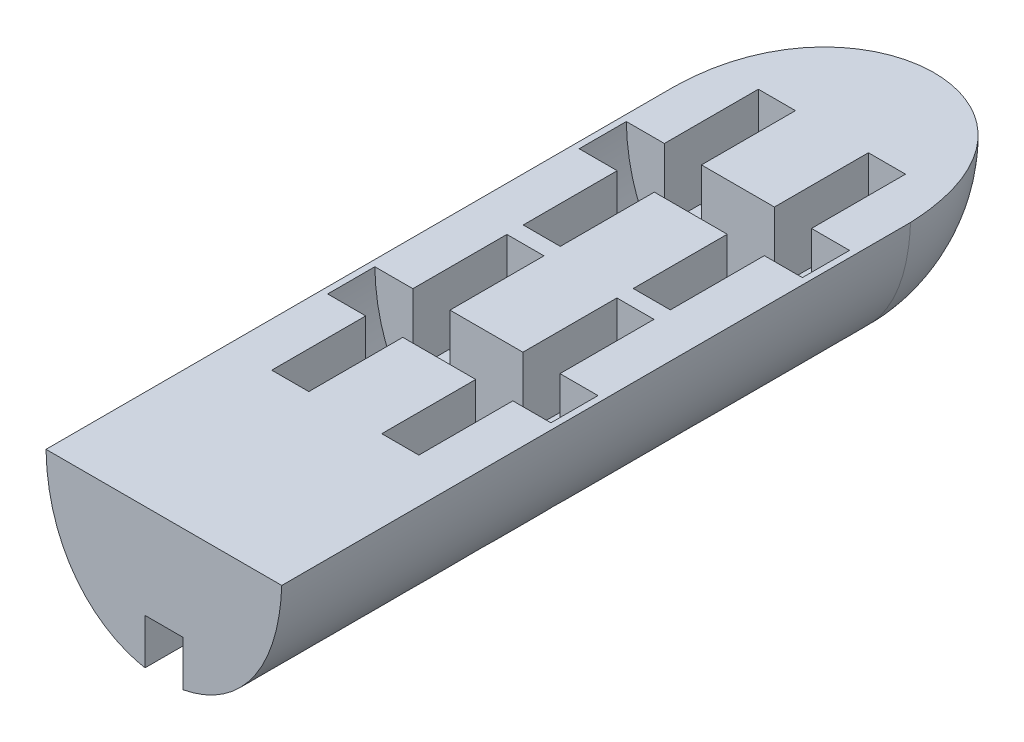
from build123d import *

# Parameters (mm, degrees)
BOSS_EXTRUDE1_DEPTH = 200
REVOLVE1_ANGLE      = 90
SKETCH7_W           = 11.8
SKETCH7_H           = 29.9
CUT_EXTRUDE1_DEPTH  = 22.5
CUT_EXTRUDE2_START  = 17.4
CUT_EXTRUDE2_DEPTH  = 15
CUT_EXTRUDE3_START  = -22.5
SKETCH7_4_W         = 11.8
SKETCH7_4_H         = 2.7
CUT_EXTRUDE3_DEPTH  = 4.7
LPATTERN1_COUNT     = 2
LPATTERN1_PITCH     = 80
CUT_EXTRUDE4_START  = -45
SKETCH9_W           = 12
SKETCH9_H           = 31.9
CUT_EXTRUDE4_DEPTH  = 15
CUT_EXTRUDE5_START  = -30
SKETCH9_3_W         = 12
SKETCH9_3_H         = 22.5
CUT_EXTRUDE5_DEPTH  = 15.9
CUT_EXTRUDE7_START  = -30
SKETCH9_4_R         = 0.5
CUT_EXTRUDE7_DEPTH  = 1


# Read off the part's stored shape, not the designer's step: Cut-Extrude2
with BuildPart() as part:
    # Sketch1 → Boss-Extrude1 (new body)
    with BuildSketch(Plane.XY):
        with BuildLine():
            Line((-37.5, 45), (37.5, 45))
            add(Edge.make_bspline(
                [(-37.5, 45), (-36.538066416, -13.829055166), (35.114143496, -16.15963011), (37.5, 45)],
                knots=[0, 0, 0, 0, 1, 1, 1, 1], degree=3))
        make_face()
    extrude(amount=BOSS_EXTRUDE1_DEPTH)

    # Sketch1<2> → Revolve1 (revolve)
    with BuildSketch(Plane.XY):
        with BuildLine():
            Line((37.5, 45), (-37.5, 45))
            add(Edge.make_bspline(
                [(-37.5, 45), (-36.538066416, -13.829055166), (35.114143496, -16.15963011), (37.5, 45)],
                knots=[0, 0, 0, 0, 1, 1, 1, 1], degree=3))
        make_face()
    revolve(axis=Axis((-37.5, 45, 0), (1, 0, 0)), revolution_arc=REVOLVE1_ANGLE)

    # Sketch7 → Cut-Extrude1 (cut)
    with BuildSketch(Plane(origin=(0, 45, 0), x_dir=(1, 0, 0), z_dir=(0, 1, 0))):
        with Locations((-17.5, -2.45)):
            Rectangle(SKETCH7_W, SKETCH7_H)
        with Locations((17.5, -2.45)):
            Rectangle(SKETCH7_W, SKETCH7_H)
        with Locations((-17.5, -47.35)):
            Rectangle(SKETCH7_W, SKETCH7_H)
        with Locations((17.5, -47.35)):
            Rectangle(SKETCH7_W, SKETCH7_H)
    cut_extrude1 = extrude(amount=-CUT_EXTRUDE1_DEPTH, mode=Mode.SUBTRACT)

    # Cut-Extrude2 outline → Cut-Extrude2 (cut)
    with BuildSketch(Plane.XY.offset(CUT_EXTRUDE2_START)):
        with BuildLine():
            Line((35.498438873, 45), (-35.499725066, 45))
            add(Edge.make_bspline(
                [(-35.499725066, 45), (-35.368650609, 37.205082169), (-34.301979481, 30.199561306), (-32.413613618, 23.984635954), (-29.817810175, 18.556811549), (-26.625334767, 13.909452625), (-22.944999564, 10.026846468), (-18.86488359, 6.899280201), (-14.482583961, 4.530449937), (-9.895330776, 2.922239991), (-5.202441131, 2.078686183), (4.195747969, 1.92933157), (8.901042205, 2.622767579), (13.515468258, 4.088792702), (17.941749121, 6.331594499), (22.084774291, 9.360328131), (25.852428778, 13.179838208), (29.158791013, 17.820930982), (31.88915848, 23.308583975), (33.93262988, 29.659944885), (35.173667519, 36.887661716), (35.498438873, 45)],
                knots=[0.000190564, 0.000190564, 0.000190564, 0.000190564, 0.000190564, 0.000190564, 0.000190564, 0.000190564, 0.000190564, 0.000190564, 0.000190564, 0.000190564, 0.5, 0.5, 0.5, 0.5, 0.5, 0.5, 0.5, 0.5, 0.5, 0.5, 0.999563761, 0.999563761, 0.999563761, 0.999563761, 0.999563761, 0.999563761, 0.999563761, 0.999563761, 0.999563761, 0.999563761, 0.999563761, 0.999563761], degree=11))
        make_face()
    cut_extrude2 = extrude(amount=CUT_EXTRUDE2_DEPTH, mode=Mode.SUBTRACT)

    # Sketch7<4> → Cut-Extrude3 (cut)
    with BuildSketch(Plane(origin=(0, 45, 0), x_dir=(1, 0, 0), z_dir=(0, 1, 0)).offset(CUT_EXTRUDE3_START)):
        with Locations((-17.5, -4.65)):
            Rectangle(SKETCH7_4_W, SKETCH7_4_H)
        with Locations((17.5, -4.55)):
            Rectangle(SKETCH7_4_W, SKETCH7_4_H)
        with Locations((17.5, -45.15)):
            Rectangle(SKETCH7_4_W, SKETCH7_4_H)
        with Locations((-17.5, -45.15)):
            Rectangle(SKETCH7_4_W, SKETCH7_4_H)
    cut_extrude3 = extrude(amount=-CUT_EXTRUDE3_DEPTH, mode=Mode.SUBTRACT)

    # LPattern1: Cut-Extrude1, Cut-Extrude2, Cut-Extrude3 ×2
    with Locations(*[(0, 0, i * LPATTERN1_PITCH) for i in range(1, LPATTERN1_COUNT)]):
        add(cut_extrude1, mode=Mode.SUBTRACT)
        add(cut_extrude2, mode=Mode.SUBTRACT)
        add(cut_extrude3, mode=Mode.SUBTRACT)

    # Sketch9 → Cut-Extrude4 (cut)
    with BuildSketch(Plane(origin=(0, 45, 0), x_dir=(1, 0, 0), z_dir=(0, 1, 0)).offset(CUT_EXTRUDE4_START)):
        with Locations((0, -184.05)):
            Rectangle(SKETCH9_W, SKETCH9_H)
    extrude(amount=CUT_EXTRUDE4_DEPTH, mode=Mode.SUBTRACT)

    # Sketch9<3> → Cut-Extrude5 (cut)
    with BuildSketch(Plane(origin=(0, 45, 0), x_dir=(1, 0, 0), z_dir=(0, 1, 0)).offset(CUT_EXTRUDE5_START)):
        with Locations((0, -184.05)):
            Rectangle(SKETCH9_3_W, SKETCH9_3_H)
    extrude(amount=CUT_EXTRUDE5_DEPTH, mode=Mode.SUBTRACT)

    # Sketch9<4> → Cut-Extrude7 (cut)
    with BuildSketch(Plane(origin=(0, 45, 0), x_dir=(1, 0, 0), z_dir=(0, 1, 0)).offset(CUT_EXTRUDE7_START)):
        with Locations(Location((0, -170.4, 0), (0, 0, 270))):
            Circle(SKETCH9_4_R)
        with Locations(Location((0, -197.7, 0), (0, 0, 270))):
            Circle(SKETCH9_4_R)
    extrude(amount=CUT_EXTRUDE7_DEPTH, mode=Mode.SUBTRACT)


solid = part.part
